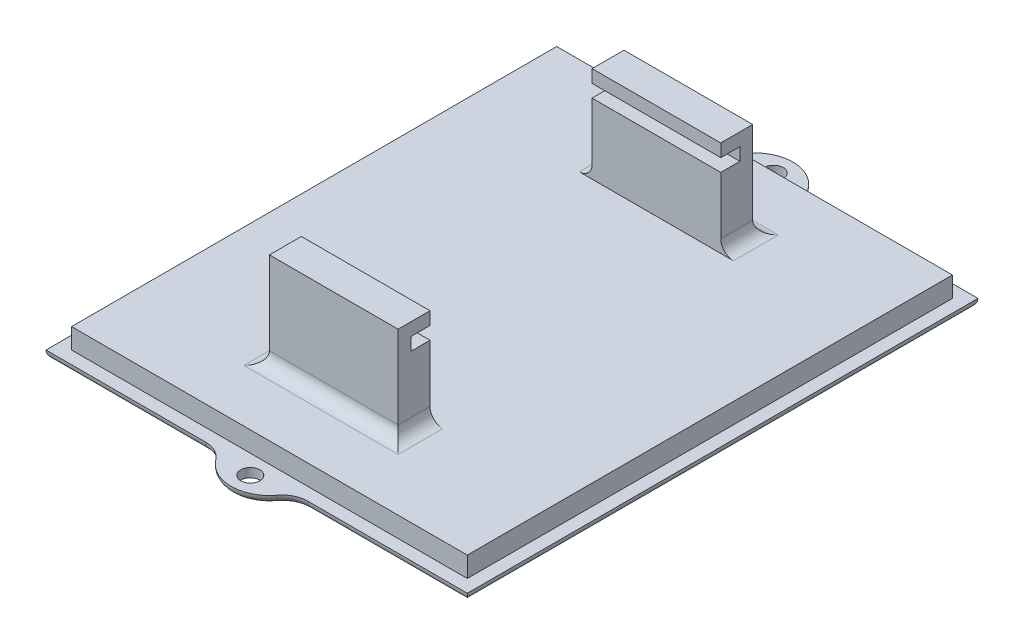
from build123d import *

# Parameters (mm, degrees)
SKETCH1_W           = 62
SKETCH1_H           = 76
BOSS_EXTRUDE1_DEPTH = 4.575
SKETCH11_W          = 66
SKETCH11_H          = 80
BOSS_EXTRUDE5_DEPTH = 1.4
BOSS_EXTRUDE3_DEPTH = 1.4
CUT_EXTRUDE3_REACH  = 57.092
SKETCH12_R          = 1.5
FILLET1_R           = 1.4
SKETCH21_W          = 20.158508521
SKETCH21_H          = 5
BOSS_EXTRUDE8_DEPTH = 15
SKETCH33_W          = 3
SKETCH33_H          = 2
CUT_EXTRUDE7_DEPTH  = 25
FILLET2_R           = 2


with BuildPart() as part:
    # Sketch1 → Boss-Extrude1 (new body)
    with BuildSketch(Plane(origin=(0, 0, 0), x_dir=(1, 0, 0), z_dir=(0, 1, 0))):
        Rectangle(SKETCH1_W, SKETCH1_H)
    extrude(amount=BOSS_EXTRUDE1_DEPTH)

    # Sketch11 → Boss-Extrude5 (add)
    with BuildSketch(Plane(origin=(0, 0, 0), x_dir=(-1, 0, 0), z_dir=(0, -1, 0))):
        Rectangle(SKETCH11_W, SKETCH11_H)
    extrude(amount=-BOSS_EXTRUDE5_DEPTH)

    # Sketch4 → Boss-Extrude3 (add)
    with BuildSketch(Plane(origin=(0, 0, 0), x_dir=(1, 0, 0), z_dir=(0, 1, 0))):
        with BuildLine():
            Line((-8, -40), (8, -40))
            ThreePointArc((8, -40), (6.211145618, -40.422291236), (4.8, -41.6))
            ThreePointArc((4.8, -41.6), (0, -44), (-4.8, -41.6))
            ThreePointArc((-4.8, -41.6), (-6.211145618, -40.422291236), (-8, -40))
        make_face()
    boss_extrude3 = extrude(amount=BOSS_EXTRUDE3_DEPTH)

    # Sketch12 → Cut-Extrude3 (cut, up to next)
    with BuildSketch(Plane(origin=(0, 1.4, 0), x_dir=(1, 0, 0), z_dir=(0, 1, 0)), mode=Mode.PRIVATE) as cut_extrude3_sk1:
        with Locations(Location((0, -41, 0), (0, 0, 270))):
            Circle(SKETCH12_R)
    cut_extrude3_tool1 = extrude(cut_extrude3_sk1.sketch, amount=-CUT_EXTRUDE3_REACH, mode=Mode.PRIVATE) & part.part
    cut_extrude3 = cut_extrude3_tool1.solids().sort_by_distance((0, 1.4, 41))[0]
    add(cut_extrude3, mode=Mode.SUBTRACT)

    # Mirror1: Boss-Extrude3, Cut-Extrude3 across plane
    add(boss_extrude3.mirror(Plane.XY))
    add(cut_extrude3.mirror(Plane.XY), mode=Mode.SUBTRACT)

    # Fillet1
    fillet1_edges = [part.edges().sort_by_distance(p)[0] for p in [
        (20.5, 0, -40),
        (6.211145618, 0, -40.422291236),
        (0, 0, -44),
        (-6.211145618, 0, -40.422291236),
        (-20.5, 0, -40),
        (-33, 0, 0),
        (-20.5, 0, 40),
        (-6.211145618, 0, 40.422291236),
        (0, 0, 44),
        (6.211145618, 0, 40.422291236),
        (20.5, 0, 40),
        (33, 0, 0),
    ]]
    fillet(fillet1_edges, radius=FILLET1_R - 0.0001)  # a hair under: the kernel refuses the full size

    # Sketch21 → Boss-Extrude8 (add)
    with BuildSketch(Plane(origin=(0, 4.575, 0), x_dir=(1, 0, 0), z_dir=(0, 1, 0))):
        with Locations((-0.149821344, -25.272162816)):
            Rectangle(SKETCH21_W, SKETCH21_H)
    boss_extrude8 = extrude(amount=BOSS_EXTRUDE8_DEPTH)

    # Sketch33 → Cut-Extrude7 (cut)
    with BuildSketch(Plane(origin=(9.929432917, 0, 0), x_dir=(0, 0, -1), z_dir=(1, 0, 0))):
        with Locations((-24.272162816, 16.575)):
            Rectangle(SKETCH33_W, SKETCH33_H)
    cut_extrude7 = extrude(amount=-CUT_EXTRUDE7_DEPTH, mode=Mode.SUBTRACT)

    # Mirror2: Boss-Extrude8, Cut-Extrude7 across plane
    add(boss_extrude8.mirror(Plane.XY))
    add(cut_extrude7.mirror(Plane.XY), mode=Mode.SUBTRACT)

    # Fillet2
    fillet2_edges = [part.edges().sort_by_distance(p)[0] for p in [
        (-10.229075604, 4.575, 25.272162816),
        (-0.149821344, 4.575, 27.772162816),
        (9.929432917, 4.575, 25.272162816),
        (9.929432917, 4.575, -25.272162816),
        (-10.229075604, 4.575, -25.272162816),
        (-0.149821344, 4.575, -27.772162816),
    ]]
    fillet(fillet2_edges, radius=FILLET2_R)


solid = part.part
